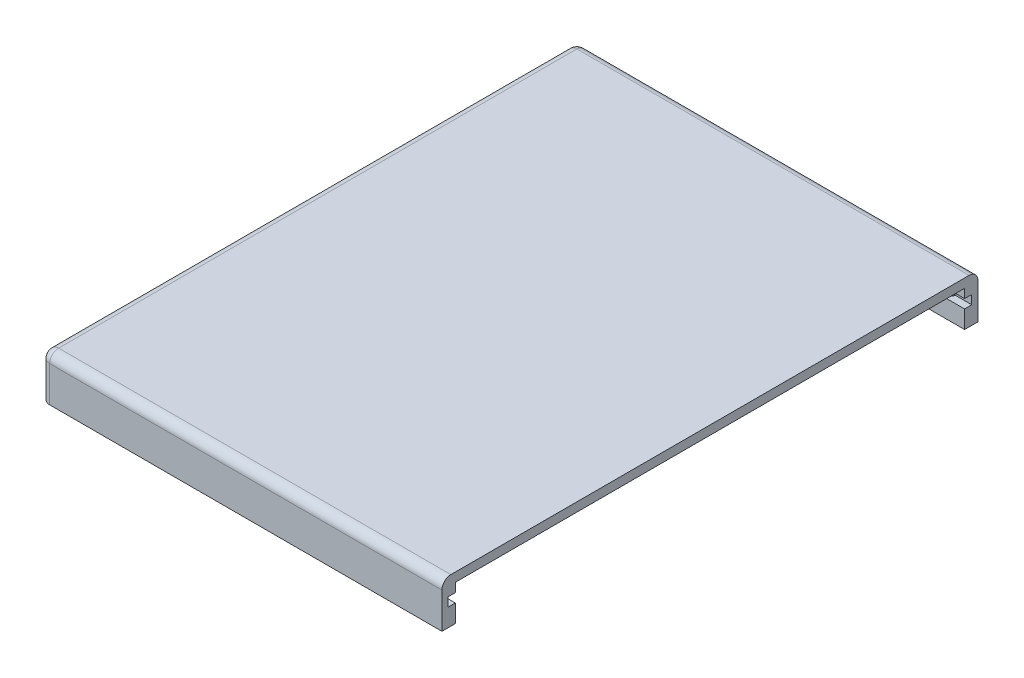
from build123d import *

# Parameters (mm, degrees)
BOSS_EXTRUDE1_DEPTH  = 5
SKETCH1_3_W          = 43.4
SKETCH1_3_H          = 57
CUT_EXTRUDE1_DEPTH   = 4
SKETCH4_W            = 43.4
SKETCH4_H            = 1
CUT_EXTRUDE2_DEPTH   = 0.8
SKETCH5_W            = 43.4
SKETCH5_H            = 1
CUT_EXTRUDE3_DEPTH   = 0.8
SKETCH6_W            = 58.6
SKETCH6_H            = 1
CUT_EXTRUDE4_DEPTH   = 0.8
FILLET1_R            = 1
SKETCH8_W            = 1.5
SKETCH8_H            = 1
BOSS_EXTRUDE2_DEPTH  = 0.5
FILLET2_R            = 0.5
FILLET2_OF_MIRROR1_R = 0.5


# Read off the part's stored shape, not the designer's step: Boss-Extrude1
with BuildPart() as part:
    # Boss-Extrude1 outline → Boss-Extrude1 (new body)
    with BuildSketch(Plane(origin=(0, 8.5, 0), x_dir=(1, 0, 0), z_dir=(0, 1, 0))):
        with BuildLine():
            Line((-23.5, -30), (20.4, -30))
            Line((20.4, -30), (20.4, 30))
            Line((20.4, 30), (-23.5, 30))
            ThreePointArc((-23.5, 30), (-24.207106781, 29.707106781), (-24.5, 29))
            Line((-24.5, 29), (-24.5, -29))
            ThreePointArc((-24.5, -29), (-24.207106781, -29.707106781), (-23.5, -30))
        make_face()
    extrude(amount=BOSS_EXTRUDE1_DEPTH)

    # Sketch1<3> → Cut-Extrude1 (cut)
    with BuildSketch(Plane(origin=(0, 8.5, 0), x_dir=(1, 0, 0), z_dir=(0, 1, 0))):
        with Locations((-1.3, 0)):
            Rectangle(SKETCH1_3_W, SKETCH1_3_H)
    extrude(amount=CUT_EXTRUDE1_DEPTH, mode=Mode.SUBTRACT)

    # Sketch4 → Cut-Extrude2 (cut)
    with BuildSketch(Plane.XY.offset(-28.5)):
        with Locations((-1.3, 11)):
            Rectangle(SKETCH4_W, SKETCH4_H)
    extrude(amount=-CUT_EXTRUDE2_DEPTH, mode=Mode.SUBTRACT)

    # Sketch5 → Cut-Extrude3 (cut)
    with BuildSketch(Plane(origin=(0, 0, 28.5), x_dir=(-1, 0, 0), z_dir=(0, 0, -1))):
        with Locations((1.3, 11)):
            Rectangle(SKETCH5_W, SKETCH5_H)
    extrude(amount=-CUT_EXTRUDE3_DEPTH, mode=Mode.SUBTRACT)

    # Sketch6 → Cut-Extrude4 (cut)
    with BuildSketch(Plane(origin=(-23, 0, 0), x_dir=(0, 0, -1), z_dir=(1, 0, 0))):
        with Locations((0, 11)):
            Rectangle(SKETCH6_W, SKETCH6_H)
    extrude(amount=-CUT_EXTRUDE4_DEPTH, mode=Mode.SUBTRACT)

    # Fillet1
    fillet1_edges = [part.edges().sort_by_distance(p)[0] for p in [
        (-1.55, 13.5, -30),
        (-24.207106781, 13.5, -29.707106781),
        (-24.5, 13.5, 0),
        (-24.207106781, 13.5, 29.707106781),
        (-1.55, 13.5, 30),
    ]]
    fillet(fillet1_edges, radius=FILLET1_R)

    # Sketch8 → Boss-Extrude2 (add)
    with BuildSketch(Plane(origin=(0, 0, 29.3), x_dir=(-1, 0, 0), z_dir=(0, 0, -1))):
        with Locations((-17.785673559, 11)):
            Rectangle(SKETCH8_W, SKETCH8_H)
    boss_extrude2 = extrude(amount=BOSS_EXTRUDE2_DEPTH)

    # Fillet2
    fillet2_edges = [part.edges().sort_by_distance(p)[0] for p in [
        (18.535673559, 11, 28.8),
        (17.035673559, 11, 28.8),
    ]]
    fillet(fillet2_edges, radius=FILLET2_R - 0.0001)  # a hair under: the kernel refuses the full size

    # Mirror1: Boss-Extrude2 across plane
    add(boss_extrude2.mirror(Plane(origin=(0, 0, 0), x_dir=(1, 0, 0), z_dir=(0, 0, -1))))

    # Fillet2 of Mirror1
    fillet2_of_mirror1_edges = [part.edges().sort_by_distance(p)[0] for p in [
        (18.535673559, 11, -28.8),
        (17.035673559, 11, -28.8),
    ]]
    fillet(fillet2_of_mirror1_edges, radius=FILLET2_OF_MIRROR1_R - 0.0001)  # a hair under: the kernel refuses the full size


solid = part.part
